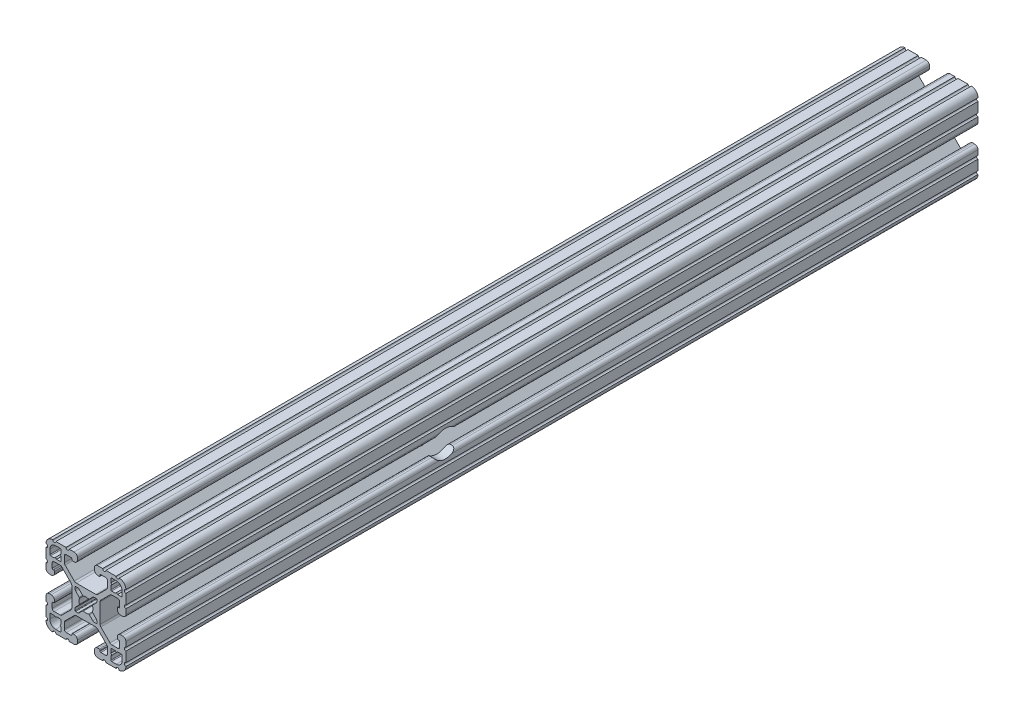
from build123d import *

# Parameters (mm, degrees)
BOSS_EXTRUDE1_DEPTH     = 406.4
CUT_EXTRUDE1_DEPTH      = 2323.966592157
CUT_EXTRUDE1_DEPTH_BACK = 2323.966592157
SKETCH2_R               = 6.35


with BuildPart() as part:
    # Sketch1 → Boss-Extrude1 (new body)
    with BuildSketch(Plane(origin=(0, 0, -2322.576), x_dir=(-1, 0, 0), z_dir=(0, 0, -1))):
        with BuildLine():
            Line((19.05, -14.325600033), (19.05, -9.4996))
            ThreePointArc((19.05, -9.4996), (18.288, -8.7376), (19.05, -7.9756))
            Line((19.05, -7.9756), (19.05, -5.6388))
            ThreePointArc((19.05, -5.6388), (18.588751759, -4.525248241), (17.4752, -4.064))
            Line((17.4752, -4.064), (16.5608, -4.064))
            ThreePointArc((16.5608, -4.064), (15.447248241, -4.525248241), (14.986, -5.6388))
            Line((14.986, -5.6388), (14.986, -6.350014224))
            ThreePointArc((14.986, -6.350014224), (15.097592316, -6.619421908), (15.367, -6.731014224))
            Line((15.367, -6.731014224), (15.6972, -6.731014224))
            ThreePointArc((15.6972, -6.731014224), (15.966607684, -6.84260654), (16.0782, -7.112014224))
            Line((16.0782, -7.112014224), (16.0782, -9.398014224))
            ThreePointArc((16.0782, -9.398014224), (15.817817928, -10.026632152), (15.1892, -10.287014224))
            Line((15.1892, -10.287014224), (12.375630013, -10.287014224))
            ThreePointArc((12.375630013, -10.287014224), (11.889622054, -10.19034123), (11.477604401, -9.915039836))
            Line((11.477604401, -9.915039836), (7.115699788, -5.553135223))
            ThreePointArc((7.115699788, -5.553135223), (6.840398394, -5.14111757), (6.7437254, -4.655109611))
            Line((6.7437254, -4.655109611), (6.7437254, 4.655109611))
            ThreePointArc((6.7437254, 4.655109611), (6.840398394, 5.14111757), (7.115699788, 5.553135223))
            Line((7.115699788, 5.553135223), (11.477604401, 9.915039836))
            ThreePointArc((11.477604401, 9.915039836), (11.889622054, 10.19034123), (12.375630013, 10.287014224))
            Line((12.375630013, 10.287014224), (15.1892, 10.287014224))
            ThreePointArc((15.1892, 10.287014224), (15.817817928, 10.026632152), (16.0782, 9.398014224))
            Line((16.0782, 9.398014224), (16.0782, 7.112014224))
            ThreePointArc((16.0782, 7.112014224), (15.966607684, 6.84260654), (15.6972, 6.731014224))
            Line((15.6972, 6.731014224), (15.367, 6.731014224))
            ThreePointArc((15.367, 6.731014224), (15.097592316, 6.619421908), (14.986, 6.350014224))
            Line((14.986, 6.350014224), (14.986, 5.6388))
            ThreePointArc((14.986, 5.6388), (15.447248241, 4.525248241), (16.5608, 4.064))
            Line((16.5608, 4.064), (17.4752, 4.064))
            ThreePointArc((17.4752, 4.064), (18.588751759, 4.525248241), (19.05, 5.6388))
            Line((19.05, 5.6388), (19.05, 7.9756))
            ThreePointArc((19.05, 7.9756), (18.288, 8.7376), (19.05, 9.4996))
            Line((19.05, 9.4996), (19.05, 14.325599984))
            ThreePointArc((19.05, 14.325599984), (18.287999986, 15.087549208), (19.049898416, 15.849600009))
            ThreePointArc((19.049898416, 15.849600009), (18.120064036, 18.120064058), (15.849599977, 19.049898414))
            ThreePointArc((15.849599977, 19.049898414), (15.0875492, 18.288000035), (14.325600017, 19.050000016))
            Line((14.325600017, 19.050000016), (9.499600001, 19.050000016))
            ThreePointArc((9.499600001, 19.050000016), (8.737600001, 18.288000016), (7.975600001, 19.050000016))
            Line((7.975600001, 19.050000016), (5.638800016, 19.050000016))
            ThreePointArc((5.638800016, 19.050000016), (4.525248257, 18.588751775), (4.064000016, 17.475200016))
            Line((4.064000016, 17.475200016), (4.064000016, 16.5608))
            ThreePointArc((4.064000016, 16.5608), (4.525248257, 15.447248241), (5.638800016, 14.986))
            Line((5.638800016, 14.986), (6.350014224, 14.986))
            ThreePointArc((6.350014224, 14.986), (6.619421908, 15.097592316), (6.731014224, 15.367))
            Line((6.731014224, 15.367), (6.731014224, 15.6972))
            ThreePointArc((6.731014224, 15.6972), (6.84260654, 15.966607684), (7.112014224, 16.0782))
            Line((7.112014224, 16.0782), (9.398014224, 16.0782))
            ThreePointArc((9.398014224, 16.0782), (10.026632152, 15.817817928), (10.287014224, 15.1892))
            Line((10.287014224, 15.1892), (10.287014224, 12.375630013))
            ThreePointArc((10.287014224, 12.375630013), (10.19034123, 11.889622054), (9.915039836, 11.477604401))
            Line((9.915039836, 11.477604401), (5.553135223, 7.115699788))
            ThreePointArc((5.553135223, 7.115699788), (5.14111757, 6.840398394), (4.655109611, 6.7437254))
            Line((4.655109611, 6.7437254), (-4.655109611, 6.7437254))
            ThreePointArc((-4.655109611, 6.7437254), (-5.14111757, 6.840398394), (-5.553135223, 7.115699788))
            Line((-5.553135223, 7.115699788), (-9.915039836, 11.477604401))
            ThreePointArc((-9.915039836, 11.477604401), (-10.19034123, 11.889622054), (-10.287014224, 12.375630013))
            Line((-10.287014224, 12.375630013), (-10.287014224, 15.1892))
            ThreePointArc((-10.287014224, 15.1892), (-10.026632152, 15.817817928), (-9.398014224, 16.0782))
            Line((-9.398014224, 16.0782), (-7.112014224, 16.0782))
            ThreePointArc((-7.112014224, 16.0782), (-6.84260654, 15.966607684), (-6.731014224, 15.6972))
            Line((-6.731014224, 15.6972), (-6.731014224, 15.367))
            ThreePointArc((-6.731014224, 15.367), (-6.619421908, 15.097592316), (-6.350014224, 14.986))
            Line((-6.350014224, 14.986), (-5.638799984, 14.986))
            ThreePointArc((-5.638799984, 14.986), (-4.525248225, 15.447248241), (-4.063999984, 16.5608))
            Line((-4.063999984, 16.5608), (-4.063999984, 17.475200016))
            ThreePointArc((-4.063999984, 17.475200016), (-4.525248225, 18.588751775), (-5.638799984, 19.050000016))
            Line((-5.638799984, 19.050000016), (-7.975599999, 19.050000016))
            ThreePointArc((-7.975599999, 19.050000016), (-8.737599999, 18.288000016), (-9.499599999, 19.050000016))
            Line((-9.499599999, 19.050000016), (-14.325599999, 19.050000016))
            ThreePointArc((-14.325599999, 19.050000016), (-15.087549199, 18.288000018), (-15.849599993, 19.049898416))
            ThreePointArc((-15.849599993, 19.049898416), (-18.120064042, 18.120064036), (-19.049898398, 15.849599976))
            ThreePointArc((-19.049898398, 15.849599976), (-18.288000019, 15.087549199), (-19.05, 14.325600017))
            Line((-19.05, 14.325600017), (-19.05, 9.4996))
            ThreePointArc((-19.05, 9.4996), (-18.288, 8.7376), (-19.05, 7.9756))
            Line((-19.05, 7.9756), (-19.05, 5.6388))
            ThreePointArc((-19.05, 5.6388), (-18.588751759, 4.525248241), (-17.4752, 4.064))
            Line((-17.4752, 4.064), (-16.5608, 4.064))
            ThreePointArc((-16.5608, 4.064), (-15.447248241, 4.525248241), (-14.986, 5.6388))
            Line((-14.986, 5.6388), (-14.986, 6.350014224))
            ThreePointArc((-14.986, 6.350014224), (-15.097592316, 6.619421908), (-15.367, 6.731014224))
            Line((-15.367, 6.731014224), (-15.6972, 6.731014224))
            ThreePointArc((-15.6972, 6.731014224), (-15.966607684, 6.84260654), (-16.0782, 7.112014224))
            Line((-16.0782, 7.112014224), (-16.0782, 9.398014224))
            ThreePointArc((-16.0782, 9.398014224), (-15.817817928, 10.026632152), (-15.1892, 10.287014224))
            Line((-15.1892, 10.287014224), (-12.375630013, 10.287014224))
            ThreePointArc((-12.375630013, 10.287014224), (-11.889622054, 10.19034123), (-11.477604401, 9.915039836))
            Line((-11.477604401, 9.915039836), (-7.115699788, 5.553135223))
            ThreePointArc((-7.115699788, 5.553135223), (-6.840398394, 5.14111757), (-6.7437254, 4.655109611))
            Line((-6.7437254, 4.655109611), (-6.7437254, -4.655109611))
            ThreePointArc((-6.7437254, -4.655109611), (-6.840398394, -5.14111757), (-7.115699788, -5.553135223))
            Line((-7.115699788, -5.553135223), (-11.477604401, -9.915039836))
            ThreePointArc((-11.477604401, -9.915039836), (-11.889622054, -10.19034123), (-12.375630013, -10.287014224))
            Line((-12.375630013, -10.287014224), (-15.1892, -10.287014224))
            ThreePointArc((-15.1892, -10.287014224), (-15.817817928, -10.026632152), (-16.0782, -9.398014224))
            Line((-16.0782, -9.398014224), (-16.0782, -7.112014224))
            ThreePointArc((-16.0782, -7.112014224), (-15.966607684, -6.84260654), (-15.6972, -6.731014224))
            Line((-15.6972, -6.731014224), (-15.367, -6.731014224))
            ThreePointArc((-15.367, -6.731014224), (-15.097592316, -6.619421908), (-14.986, -6.350014224))
            Line((-14.986, -6.350014224), (-14.986, -5.6388))
            ThreePointArc((-14.986, -5.6388), (-15.447248241, -4.525248241), (-16.5608, -4.064))
            Line((-16.5608, -4.064), (-17.4752, -4.064))
            ThreePointArc((-17.4752, -4.064), (-18.588751759, -4.525248241), (-19.05, -5.6388))
            Line((-19.05, -5.6388), (-19.05, -7.9756))
            ThreePointArc((-19.05, -7.9756), (-18.288, -8.7376), (-19.05, -9.4996))
            Line((-19.05, -9.4996), (-19.05, -14.3256))
            ThreePointArc((-19.05, -14.3256), (-18.288000002, -15.0875492), (-19.0498984, -15.849599993))
            ThreePointArc((-19.0498984, -15.849599993), (-18.120064019, -18.120064043), (-15.84959996, -19.049898399))
            ThreePointArc((-15.84959996, -19.049898399), (-15.087549183, -18.288000019), (-14.325600001, -19.050000001))
            Line((-14.325600001, -19.050000001), (-9.499599984, -19.050000001))
            ThreePointArc((-9.499599984, -19.050000001), (-8.737599984, -18.288000001), (-7.975599984, -19.050000001))
            Line((-7.975599984, -19.050000001), (-5.638799984, -19.050000001))
            ThreePointArc((-5.638799984, -19.050000001), (-4.525248225, -18.58875176), (-4.063999984, -17.475200001))
            Line((-4.063999984, -17.475200001), (-4.063999984, -16.5608))
            ThreePointArc((-4.063999984, -16.5608), (-4.525248225, -15.447248241), (-5.638799984, -14.986))
            Line((-5.638799984, -14.986), (-6.350014224, -14.986))
            ThreePointArc((-6.350014224, -14.986), (-6.619421908, -15.097592316), (-6.731014224, -15.367))
            Line((-6.731014224, -15.367), (-6.731014224, -15.6972))
            ThreePointArc((-6.731014224, -15.6972), (-6.84260654, -15.966607684), (-7.112014224, -16.0782))
            Line((-7.112014224, -16.0782), (-9.398014224, -16.0782))
            ThreePointArc((-9.398014224, -16.0782), (-10.026632152, -15.817817928), (-10.287014224, -15.1892))
            Line((-10.287014224, -15.1892), (-10.287014224, -12.375630013))
            ThreePointArc((-10.287014224, -12.375630013), (-10.19034123, -11.889622054), (-9.915039836, -11.477604401))
            Line((-9.915039836, -11.477604401), (-5.553135223, -7.115699788))
            ThreePointArc((-5.553135223, -7.115699788), (-5.14111757, -6.840398394), (-4.655109611, -6.7437254))
            Line((-4.655109611, -6.7437254), (4.655109611, -6.7437254))
            ThreePointArc((4.655109611, -6.7437254), (5.14111757, -6.840398394), (5.553135223, -7.115699788))
            Line((5.553135223, -7.115699788), (9.915039836, -11.477604401))
            ThreePointArc((9.915039836, -11.477604401), (10.19034123, -11.889622054), (10.287014224, -12.375630013))
            Line((10.287014224, -12.375630013), (10.287014224, -15.1892))
            ThreePointArc((10.287014224, -15.1892), (10.026632152, -15.817817928), (9.398014224, -16.0782))
            Line((9.398014224, -16.0782), (7.112014224, -16.0782))
            ThreePointArc((7.112014224, -16.0782), (6.84260654, -15.966607684), (6.731014224, -15.6972))
            Line((6.731014224, -15.6972), (6.731014224, -15.367))
            ThreePointArc((6.731014224, -15.367), (6.619421908, -15.097592316), (6.350014224, -14.986))
            Line((6.350014224, -14.986), (5.638800016, -14.986))
            ThreePointArc((5.638800016, -14.986), (4.525248257, -15.447248241), (4.064000016, -16.5608))
            Line((4.064000016, -16.5608), (4.064000016, -17.475200001))
            ThreePointArc((4.064000016, -17.475200001), (4.525248257, -18.58875176), (5.638800016, -19.050000001))
            Line((5.638800016, -19.050000001), (7.975600016, -19.050000001))
            ThreePointArc((7.975600016, -19.050000001), (8.737600016, -18.288000001), (9.499600016, -19.050000001))
            Line((9.499600016, -19.050000001), (14.325600016, -19.050000001))
            ThreePointArc((14.325600016, -19.050000001), (15.087549216, -18.288000002), (15.849600009, -19.0498984))
            ThreePointArc((15.849600009, -19.0498984), (18.120064059, -18.12006402), (19.049898415, -15.849599961))
            ThreePointArc((19.049898415, -15.849599961), (18.288000034, -15.087549207), (19.05, -14.325600033))
        make_face()
        with BuildLine():
            Line((17.246614224, 14.452614224), (17.246614224, 12.242814224))
            ThreePointArc((17.246614224, 12.242814224), (17.135021908, 11.97340654), (16.865614224, 11.861814224))
            Line((16.865614224, 11.861814224), (15.092694224, 11.861814224))
            Line((15.092694224, 11.861814224), (14.554214224, 12.400294224))
            Line((14.554214224, 12.400294224), (14.015734224, 11.861814224))
            Line((14.015734224, 11.861814224), (12.242814224, 11.861814224))
            ThreePointArc((12.242814224, 11.861814224), (11.97340654, 11.97340654), (11.861814224, 12.242814224))
            Line((11.861814224, 12.242814224), (11.861814224, 14.015734224))
            Line((11.861814224, 14.015734224), (12.400294224, 14.554214224))
            Line((12.400294224, 14.554214224), (11.861814224, 15.092694224))
            Line((11.861814224, 15.092694224), (11.861814224, 16.865614224))
            ThreePointArc((11.861814224, 16.865614224), (11.97340654, 17.135021908), (12.242814224, 17.246614224))
            Line((12.242814224, 17.246614224), (14.452614224, 17.246614224))
            ThreePointArc((14.452614224, 17.246614224), (16.428270571, 16.428270571), (17.246614224, 14.452614224))
        make_face(mode=Mode.SUBTRACT)
        with BuildLine():
            Line((17.246614224, -12.242814224), (17.246614224, -14.452614224))
            ThreePointArc((17.246614224, -14.452614224), (16.428270571, -16.428270571), (14.452614224, -17.246614224))
            Line((14.452614224, -17.246614224), (12.242814224, -17.246614224))
            ThreePointArc((12.242814224, -17.246614224), (11.97340654, -17.135021908), (11.861814224, -16.865614224))
            Line((11.861814224, -16.865614224), (11.861814224, -15.092694224))
            Line((11.861814224, -15.092694224), (12.400294224, -14.554214224))
            Line((12.400294224, -14.554214224), (11.861814224, -14.015734224))
            Line((11.861814224, -14.015734224), (11.861814224, -12.242814224))
            ThreePointArc((11.861814224, -12.242814224), (11.97340654, -11.97340654), (12.242814224, -11.861814224))
            Line((12.242814224, -11.861814224), (14.015734224, -11.861814224))
            Line((14.015734224, -11.861814224), (14.554214224, -12.400294224))
            Line((14.554214224, -12.400294224), (15.092694224, -11.861814224))
            Line((15.092694224, -11.861814224), (16.865614224, -11.861814224))
            ThreePointArc((16.865614224, -11.861814224), (17.135021908, -11.97340654), (17.246614224, -12.242814224))
        make_face(mode=Mode.SUBTRACT)
        with BuildLine():
            Line((5.1689, -3.920689755), (5.1689, -4.9149))
            ThreePointArc((5.1689, -4.9149), (5.094505122, -5.094505122), (4.9149, -5.1689))
            Line((4.9149, -5.1689), (3.920689755, -5.1689))
            ThreePointArc((3.920689755, -5.1689), (3.580484184, -5.101228904), (3.292071827, -4.908517928))
            Line((3.292071827, -4.908517928), (1.582347442, -3.198793543))
            ThreePointArc((1.582347442, -3.198793543), (1.393016011, -3.095711236), (1.178048687, -3.111879183))
            ThreePointArc((1.178048687, -3.111879183), (0, -3.3274), (-1.178048687, -3.111879183))
            ThreePointArc((-1.178048687, -3.111879183), (-1.393016011, -3.095711236), (-1.582347442, -3.198793543))
            Line((-1.582347442, -3.198793543), (-3.292071827, -4.908517928))
            ThreePointArc((-3.292071827, -4.908517928), (-3.580484184, -5.101228904), (-3.920689755, -5.1689))
            Line((-3.920689755, -5.1689), (-4.9149, -5.1689))
            ThreePointArc((-4.9149, -5.1689), (-5.094505122, -5.094505122), (-5.1689, -4.9149))
            Line((-5.1689, -4.9149), (-5.1689, -3.920689755))
            ThreePointArc((-5.1689, -3.920689755), (-5.101228904, -3.580484184), (-4.908517928, -3.292071827))
            Line((-4.908517928, -3.292071827), (-3.198793543, -1.582347442))
            ThreePointArc((-3.198793543, -1.582347442), (-3.095711236, -1.393016011), (-3.111879183, -1.178048687))
            ThreePointArc((-3.111879183, -1.178048687), (-3.3274, 0), (-3.111879183, 1.178048687))
            ThreePointArc((-3.111879183, 1.178048687), (-3.095711236, 1.393016011), (-3.198793543, 1.582347442))
            Line((-3.198793543, 1.582347442), (-4.908517928, 3.292071827))
            ThreePointArc((-4.908517928, 3.292071827), (-5.101228904, 3.580484184), (-5.1689, 3.920689755))
            Line((-5.1689, 3.920689755), (-5.1689, 4.9149))
            ThreePointArc((-5.1689, 4.9149), (-5.094505122, 5.094505122), (-4.9149, 5.1689))
            Line((-4.9149, 5.1689), (-3.920689755, 5.1689))
            ThreePointArc((-3.920689755, 5.1689), (-3.580484184, 5.101228904), (-3.292071827, 4.908517928))
            Line((-3.292071827, 4.908517928), (-1.582347442, 3.198793543))
            ThreePointArc((-1.582347442, 3.198793543), (-1.393016011, 3.095711236), (-1.178048687, 3.111879183))
            ThreePointArc((-1.178048687, 3.111879183), (0, 3.3274), (1.178048687, 3.111879183))
            ThreePointArc((1.178048687, 3.111879183), (1.393016011, 3.095711236), (1.582347442, 3.198793543))
            Line((1.582347442, 3.198793543), (3.292071827, 4.908517928))
            ThreePointArc((3.292071827, 4.908517928), (3.580484184, 5.101228904), (3.920689755, 5.1689))
            Line((3.920689755, 5.1689), (4.9149, 5.1689))
            ThreePointArc((4.9149, 5.1689), (5.094505122, 5.094505122), (5.1689, 4.9149))
            Line((5.1689, 4.9149), (5.1689, 3.920689755))
            ThreePointArc((5.1689, 3.920689755), (5.101228904, 3.580484184), (4.908517928, 3.292071827))
            Line((4.908517928, 3.292071827), (3.198793543, 1.582347442))
            ThreePointArc((3.198793543, 1.582347442), (3.095711236, 1.393016011), (3.111879183, 1.178048687))
            ThreePointArc((3.111879183, 1.178048687), (3.3274, 0), (3.111879183, -1.178048687))
            ThreePointArc((3.111879183, -1.178048687), (3.095711236, -1.393016011), (3.198793543, -1.582347442))
            Line((3.198793543, -1.582347442), (4.908517928, -3.292071827))
            ThreePointArc((4.908517928, -3.292071827), (5.101228904, -3.580484184), (5.1689, -3.920689755))
        make_face(mode=Mode.SUBTRACT)
        with BuildLine():
            Line((-11.861814224, -12.242814224), (-11.861814224, -14.015734224))
            Line((-11.861814224, -14.015734224), (-12.400294224, -14.554214224))
            Line((-12.400294224, -14.554214224), (-11.861814224, -15.092694224))
            Line((-11.861814224, -15.092694224), (-11.861814224, -16.865614224))
            ThreePointArc((-11.861814224, -16.865614224), (-11.97340654, -17.135021908), (-12.242814224, -17.246614224))
            Line((-12.242814224, -17.246614224), (-14.452614224, -17.246614224))
            ThreePointArc((-14.452614224, -17.246614224), (-16.428270571, -16.428270571), (-17.246614224, -14.452614224))
            Line((-17.246614224, -14.452614224), (-17.246614224, -12.242814224))
            ThreePointArc((-17.246614224, -12.242814224), (-17.135021908, -11.97340654), (-16.865614224, -11.861814224))
            Line((-16.865614224, -11.861814224), (-15.092694224, -11.861814224))
            Line((-15.092694224, -11.861814224), (-14.554214224, -12.400294224))
            Line((-14.554214224, -12.400294224), (-14.015734224, -11.861814224))
            Line((-14.015734224, -11.861814224), (-12.242814224, -11.861814224))
            ThreePointArc((-12.242814224, -11.861814224), (-11.97340654, -11.97340654), (-11.861814224, -12.242814224))
        make_face(mode=Mode.SUBTRACT)
        with BuildLine():
            Line((-11.861814224, 16.865614224), (-11.861814224, 15.092694224))
            Line((-11.861814224, 15.092694224), (-12.400294224, 14.554214224))
            Line((-12.400294224, 14.554214224), (-11.861814224, 14.015734224))
            Line((-11.861814224, 14.015734224), (-11.861814224, 12.242814224))
            ThreePointArc((-11.861814224, 12.242814224), (-11.97340654, 11.97340654), (-12.242814224, 11.861814224))
            Line((-12.242814224, 11.861814224), (-14.015734224, 11.861814224))
            Line((-14.015734224, 11.861814224), (-14.554214224, 12.400294224))
            Line((-14.554214224, 12.400294224), (-15.092694224, 11.861814224))
            Line((-15.092694224, 11.861814224), (-16.865614224, 11.861814224))
            ThreePointArc((-16.865614224, 11.861814224), (-17.135021908, 11.97340654), (-17.246614224, 12.242814224))
            Line((-17.246614224, 12.242814224), (-17.246614224, 14.452614224))
            ThreePointArc((-17.246614224, 14.452614224), (-16.428270571, 16.428270571), (-14.452614224, 17.246614224))
            Line((-14.452614224, 17.246614224), (-12.242814224, 17.246614224))
            ThreePointArc((-12.242814224, 17.246614224), (-11.97340654, 17.135021908), (-11.861814224, 16.865614224))
        make_face(mode=Mode.SUBTRACT)
    extrude(amount=-BOSS_EXTRUDE1_DEPTH)

    # Sketch2 → Cut-Extrude1 (cut, two sides: drawn at the far end of the back side and taken through both)
    with BuildSketch(Plane(origin=(19.05, 0, 0), x_dir=(0, 0, -1), z_dir=(1, 0, 0)).offset(-CUT_EXTRUDE1_DEPTH_BACK)):
        with Locations((2068.576, 0)):
            Circle(SKETCH2_R)
    extrude(amount=CUT_EXTRUDE1_DEPTH + CUT_EXTRUDE1_DEPTH_BACK, mode=Mode.SUBTRACT)


solid = part.part
